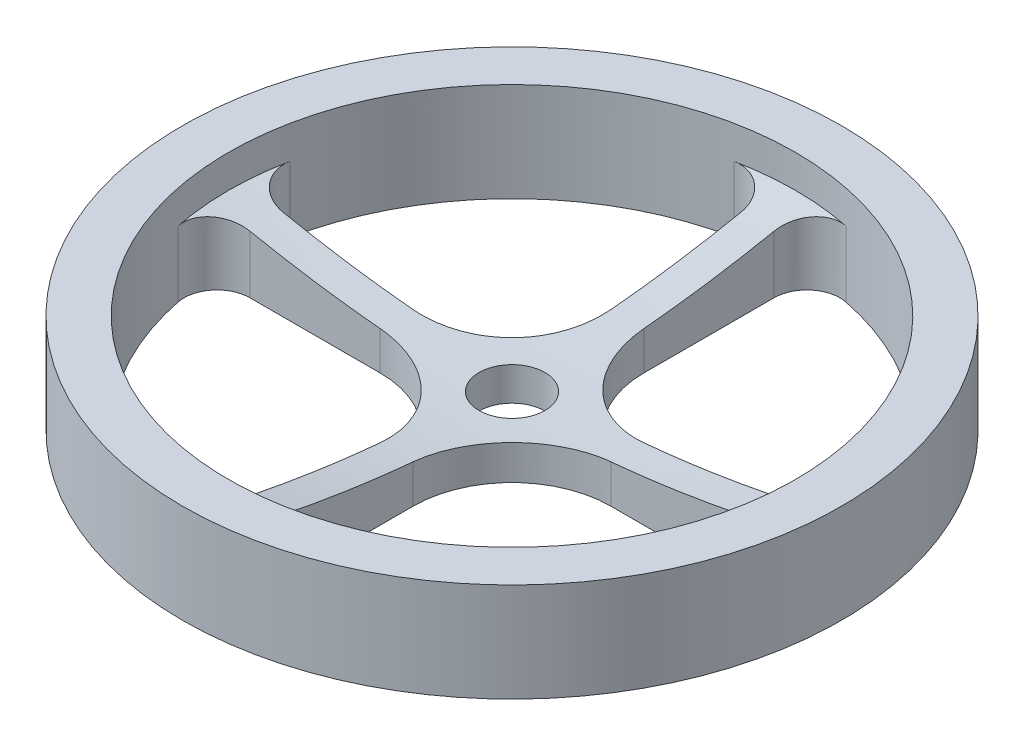
from build123d import *

# Parameters (mm, degrees)
SKETCH1_R          = 12.7
THREAD_BLANK_DEPTH = 3.81
VENT_DEPTH         = 19.360177014
SKETCH6_R          = 1.27
CENTER_HOLE_DEPTH  = 19.360177014


with BuildPart() as part:
    # Sketch1 → Thread Blank (new body)
    with BuildSketch(Plane(origin=(0, 0, 0), x_dir=(1, 0, 0), z_dir=(0, 1, 0))):
        Circle(SKETCH1_R)
    extrude(amount=THREAD_BLANK_DEPTH)

    # Sketch4 → Center Depression (revolve, cut)
    with BuildSketch(Plane.XY):
        with BuildLine():
            Line((0, 3.81), (10.922, 3.81))
            Line((10.922, 3.81), (10.922, 2.54))
            ThreePointArc((10.922, 2.54), (5.497794649, 1.588566021), (0, 1.27))
            Line((0, 1.27), (0, 3.81))
        make_face()
    revolve(axis=Axis((0, 0, 0), (0, 1, 0)), mode=Mode.SUBTRACT)

    # Sketch5 → Vent (cut, through all)
    with BuildSketch(Plane(origin=(0, 0, 0), x_dir=(1, 0, 0), z_dir=(0, 1, 0))):
        with BuildLine():
            Line((0.635, 9.46213924), (0.635, 4.445))
            ThreePointArc((0.635, 4.445), (1.750923164, 1.750923164), (4.445, 0.635))
            Line((4.445, 0.635), (9.46213924, 0.635))
            ThreePointArc((9.46213924, 0.635), (10.444797758, 1.100461476), (10.707157561, 2.155657895))
            ThreePointArc((10.707157561, 2.155657895), (7.723020264, 7.723020264), (2.155657895, 10.707157561))
            ThreePointArc((2.155657895, 10.707157561), (1.100461476, 10.444797758), (0.635, 9.46213924))
        make_face()
        with BuildLine():
            Line((-4.445, 0.635), (-9.46213924, 0.635))
            ThreePointArc((-9.46213924, 0.635), (-10.444797758, 1.100461476), (-10.707157561, 2.155657895))
            ThreePointArc((-10.707157561, 2.155657895), (-7.723020264, 7.723020264), (-2.155657895, 10.707157561))
            ThreePointArc((-2.155657895, 10.707157561), (-1.100461476, 10.444797758), (-0.635, 9.46213924))
            Line((-0.635, 9.46213924), (-0.635, 4.445))
            ThreePointArc((-0.635, 4.445), (-1.750923164, 1.750923164), (-4.445, 0.635))
        make_face()
        with BuildLine():
            Line((-0.635, -9.46213924), (-0.635, -4.445))
            ThreePointArc((-0.635, -4.445), (-1.750923164, -1.750923164), (-4.445, -0.635))
            Line((-4.445, -0.635), (-9.46213924, -0.635))
            ThreePointArc((-9.46213924, -0.635), (-10.444797758, -1.100461476), (-10.707157561, -2.155657895))
            ThreePointArc((-10.707157561, -2.155657895), (-7.723020264, -7.723020264), (-2.155657895, -10.707157561))
            ThreePointArc((-2.155657895, -10.707157561), (-1.100461476, -10.444797758), (-0.635, -9.46213924))
        make_face()
        with BuildLine():
            Line((4.445, -0.635), (9.46213924, -0.635))
            ThreePointArc((9.46213924, -0.635), (10.444797758, -1.100461476), (10.707157561, -2.155657895))
            ThreePointArc((10.707157561, -2.155657895), (7.723020264, -7.723020264), (2.155657895, -10.707157561))
            ThreePointArc((2.155657895, -10.707157561), (1.100461476, -10.444797758), (0.635, -9.46213924))
            Line((0.635, -9.46213924), (0.635, -4.445))
            ThreePointArc((0.635, -4.445), (1.750923164, -1.750923164), (4.445, -0.635))
        make_face()
    extrude(amount=VENT_DEPTH, mode=Mode.SUBTRACT)

    # Sketch6 → Center Hole (cut, through all)
    with BuildSketch(Plane(origin=(0, 0, 0), x_dir=(1, 0, 0), z_dir=(0, 1, 0))):
        Circle(SKETCH6_R)
    extrude(amount=CENTER_HOLE_DEPTH, mode=Mode.SUBTRACT)


solid = part.part
